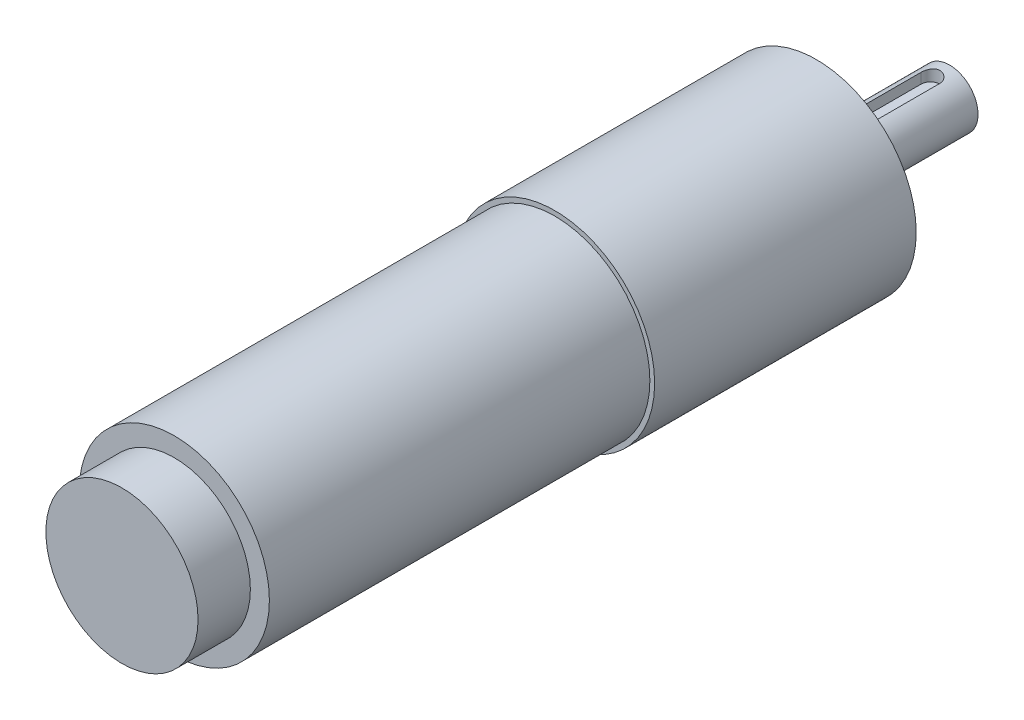
from build123d import *

# Parameters (mm, degrees)
SKETCH_1_R                  = 21
EXTRUDE_353_DEPTH           = 55
SKETCH_2_R                  = 20
EXTRUDE_453_DEPTH           = 80
SKETCH_3_R                  = 16
EXTRUDE_577_DEPTH           = 11
SKETCH_5_R                  = 14
EXTRUDE_673_DEPTH           = 3
SKETCH_4_R                  = 6
EXTRUDE_795_DEPTH           = 25
CUT_EXTRUDE_1_DEPTH         = 2.5
HOLE_WIZARD_M4_1_AT_2_COUNT = 2
HOLE_WIZARD_M4_1_AT_2_PITCH = 24.748737342
HOLE_WIZARD_M4_1_AT_3_COUNT = 2
HOLE_WIZARD_M4_1_AT_3_PITCH = 35
HOLE_WIZARD_M4_1_AT_4_COUNT = 2
HOLE_WIZARD_M4_1_AT_4_PITCH = 24.748737342


with BuildPart() as part:
    # 草图1 → Extrude 353 (new body)
    with BuildSketch(Plane.XY):
        Circle(SKETCH_1_R)
    extrude(amount=EXTRUDE_353_DEPTH)

    # 草图2 → Extrude 453 (add)
    with BuildSketch(Plane.XY.offset(55)):
        Circle(SKETCH_2_R)
    extrude(amount=EXTRUDE_453_DEPTH)

    # 草图3 → Extrude 577 (add)
    with BuildSketch(Plane.XY.offset(135)):
        Circle(SKETCH_3_R)
    extrude(amount=EXTRUDE_577_DEPTH)

    # 草图5 → Extrude 673 (add)
    with BuildSketch(Plane(origin=(0, 0, 0), x_dir=(-1, 0, 0), z_dir=(0, 0, -1))):
        Circle(SKETCH_5_R)
    extrude(amount=EXTRUDE_673_DEPTH)

    # 草图7 → M4 螺纹孔1 (revolve, cut)
    with BuildSketch(Plane(origin=(0, 17.5, 0), x_dir=(0, 1, 0), z_dir=(1, 0, 0))):
        Polygon((0, 0), (0, 5.991420021), (1.65, 5), (1.65, 0), align=None)
    hole_wizard_m4_1 = revolve(axis=Axis((0, 17.5, -6.35), (0, 0, 1)), mode=Mode.SUBTRACT)

    # M4 螺纹孔1 at 2: M4 螺纹孔1 ×2
    with Locations(*[Vector(-0.7071067811865575, -0.7071067811865376, 0) * (i * HOLE_WIZARD_M4_1_AT_2_PITCH) for i in range(1, HOLE_WIZARD_M4_1_AT_2_COUNT)]):
        add(hole_wizard_m4_1, mode=Mode.SUBTRACT)

    # M4 螺纹孔1 at 3: M4 螺纹孔1 ×2
    with Locations(*[(0, -i * HOLE_WIZARD_M4_1_AT_3_PITCH, 0) for i in range(1, HOLE_WIZARD_M4_1_AT_3_COUNT)]):
        add(hole_wizard_m4_1, mode=Mode.SUBTRACT)

    # M4 螺纹孔1 at 4: M4 螺纹孔1 ×2
    with Locations(*[Vector(0.7071067811865376, -0.7071067811865576, 0) * (i * HOLE_WIZARD_M4_1_AT_4_PITCH) for i in range(1, HOLE_WIZARD_M4_1_AT_4_COUNT)]):
        add(hole_wizard_m4_1, mode=Mode.SUBTRACT)


with BuildPart() as body_2:
    # 草图4 → Extrude 795 (new body)
    with BuildSketch(Plane(origin=(0, 0, -3), x_dir=(-1, 0, 0), z_dir=(0, 0, -1))):
        Circle(SKETCH_4_R)
    extrude(amount=EXTRUDE_795_DEPTH)

    # 草图6 → 切除-拉伸1 (cut)
    with BuildSketch(Plane(origin=(0, 6, 0), x_dir=(-1, 0, 0), z_dir=(0, 1, 0))):
        with BuildLine():
            Line((-2, -24), (-2, -8))
            ThreePointArc((-2, -8), (0, -6), (2, -8))
            Line((2, -8), (2, -24))
            ThreePointArc((2, -24), (0, -26), (-2, -24))
        make_face()
    extrude(amount=-CUT_EXTRUDE_1_DEPTH, mode=Mode.SUBTRACT)


solid = Compound([part.part, body_2.part])
